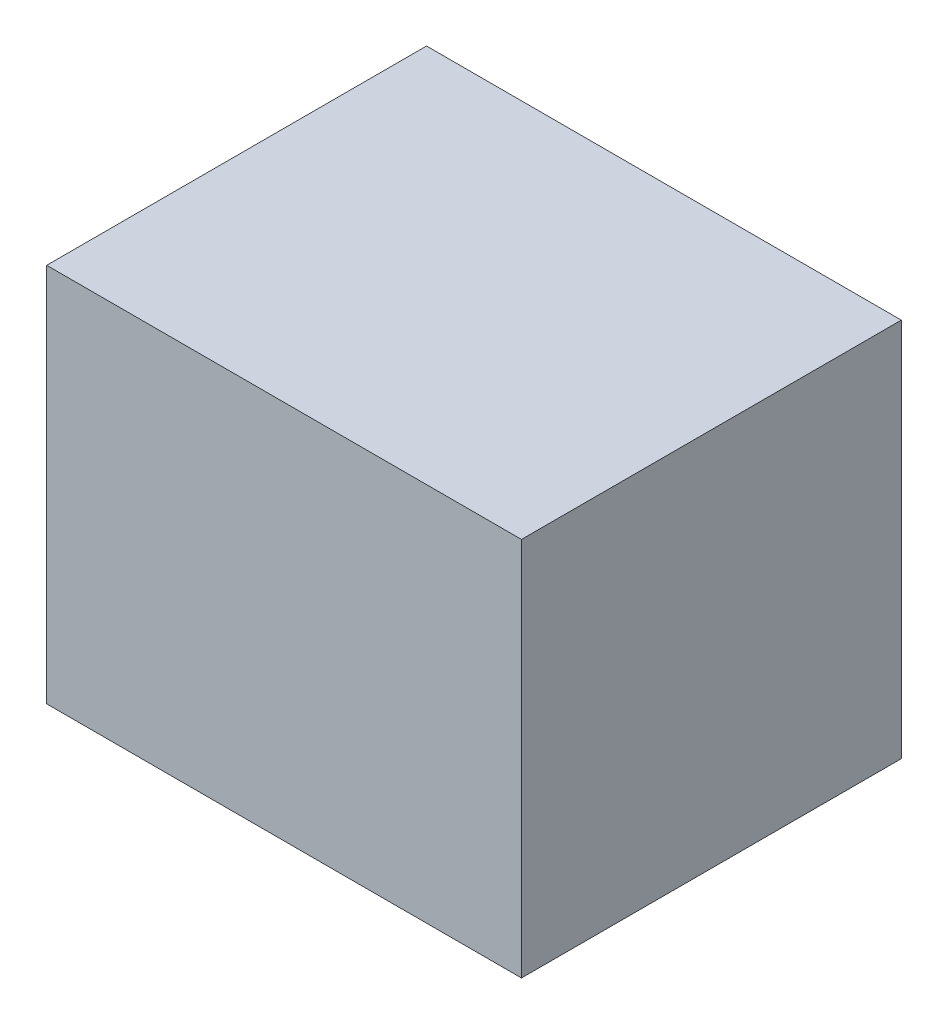
from build123d import *

# Parameters (mm, degrees)
SZKIC1_W                    = 500
SZKIC1_H                    = 60
DODANIE_WYCI_GNI_CIE1_DEPTH = 60
SZKIC2_R                    = 25
WYTNIJ_WYCI_GNI_CIE1_DEPTH  = 25
ZAOKR_GLENIE2_R             = 25
SZKIC5_W                    = 60
SZKIC5_H                    = 60
WYTNIJ_WYCI_GNI_CIE2_DEPTH  = 400
SZKIC6_W                    = 60
SZKIC6_H                    = 60
WYTNIJ_WYCI_GNI_CIE4_DEPTH  = 25


with BuildPart() as part:
    # Szkic1 → Dodanie-wyciągnięcie1 (new body)
    with BuildSketch(Plane.XY):
        Rectangle(SZKIC1_W, SZKIC1_H)
    extrude(amount=DODANIE_WYCI_GNI_CIE1_DEPTH)

    # Szkic2 → Wytnij-wyciągnięcie1 (cut)
    with BuildSketch(Plane(origin=(0, 0, 0), x_dir=(-1, 0, 0), z_dir=(0, 0, -1))):
        with Locations((-187.5, 0)):
            Circle(SZKIC2_R)
        with Locations((-125, 0)):
            Circle(SZKIC2_R)
        with Locations((-62.5, 0)):
            Circle(SZKIC2_R)
        Circle(SZKIC2_R)
        with Locations((62.5, 0)):
            Circle(SZKIC2_R)
        with Locations((125, 0)):
            Circle(SZKIC2_R)
        with Locations((187.5, 0)):
            Circle(SZKIC2_R)
    extrude(amount=-WYTNIJ_WYCI_GNI_CIE1_DEPTH, mode=Mode.SUBTRACT)

    # Zaokrąglenie2
    zaokr_glenie2_edges = [part.edges().sort_by_distance(p)[0] for p in [
        (212.5, 0, 25),
        (150, 0, 25),
        (87.5, 0, 25),
        (25, 0, 25),
        (-37.5, 0, 25),
        (-100, 0, 25),
        (-162.5, 0, 25),
    ]]
    fillet(zaokr_glenie2_edges, radius=ZAOKR_GLENIE2_R - 0.0001)  # a hair under: the kernel refuses the full size

    # Szkic5 → Wytnij-wyciągnięcie2 (cut)
    with BuildSketch(Plane(origin=(250, 0, 0), x_dir=(0, 0, -1), z_dir=(1, 0, 0))):
        with Locations((-30, 0)):
            Rectangle(SZKIC5_W, SZKIC5_H)
    extrude(amount=-WYTNIJ_WYCI_GNI_CIE2_DEPTH, mode=Mode.SUBTRACT)

    # Szkic6 → Wytnij-wyciągnięcie4 (cut)
    with BuildSketch(Plane.ZY.offset(250)):
        with Locations((30, 0)):
            Rectangle(SZKIC6_W, SZKIC6_H)
    extrude(amount=-WYTNIJ_WYCI_GNI_CIE4_DEPTH, mode=Mode.SUBTRACT)


solid = part.part
